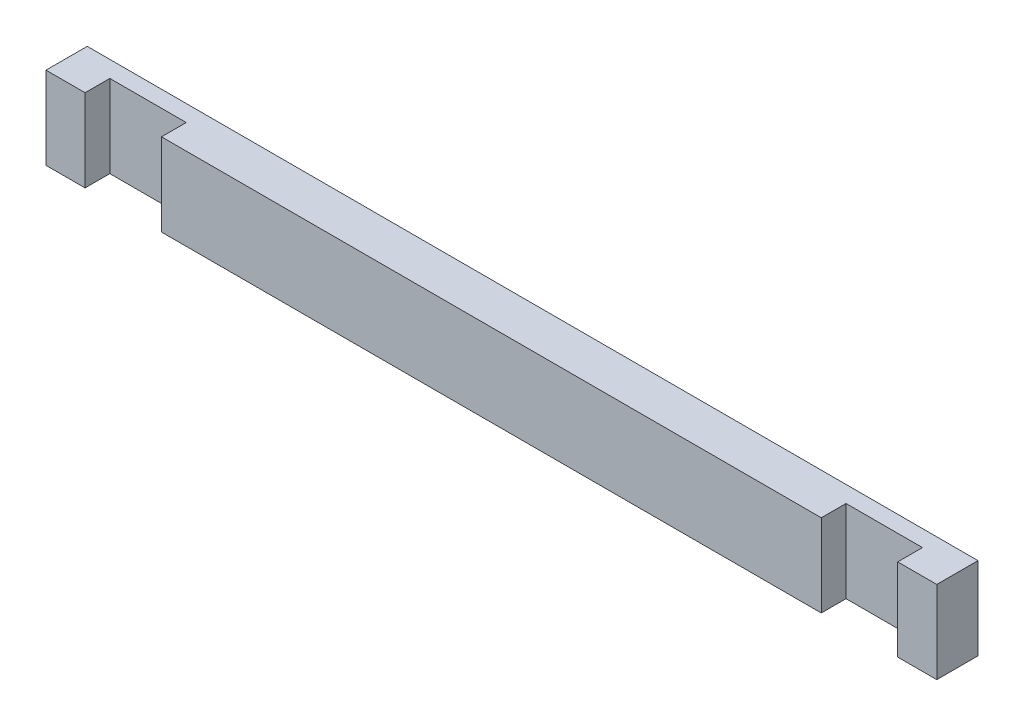
from build123d import *

# Parameters (mm, degrees)
EXTRUDE_1_DEPTH = 50


with BuildPart() as part:
    # Эскиз1 → Бобышка-Вытянуть1 (new body)
    with BuildSketch(Plane(origin=(0, 0, 0), x_dir=(1, 0, 0), z_dir=(0, 1, 0))):
        Polygon((200, 0), (-200, 0), (-200, 15), (-246.316878875, 15), (-246.316878875, 0), (-270, 0), (-270, 25), (270, 25), (270, 0), (246.316878875, 0), (246.316878875, 15), (200, 15), align=None)
    extrude(amount=EXTRUDE_1_DEPTH)


solid = part.part
